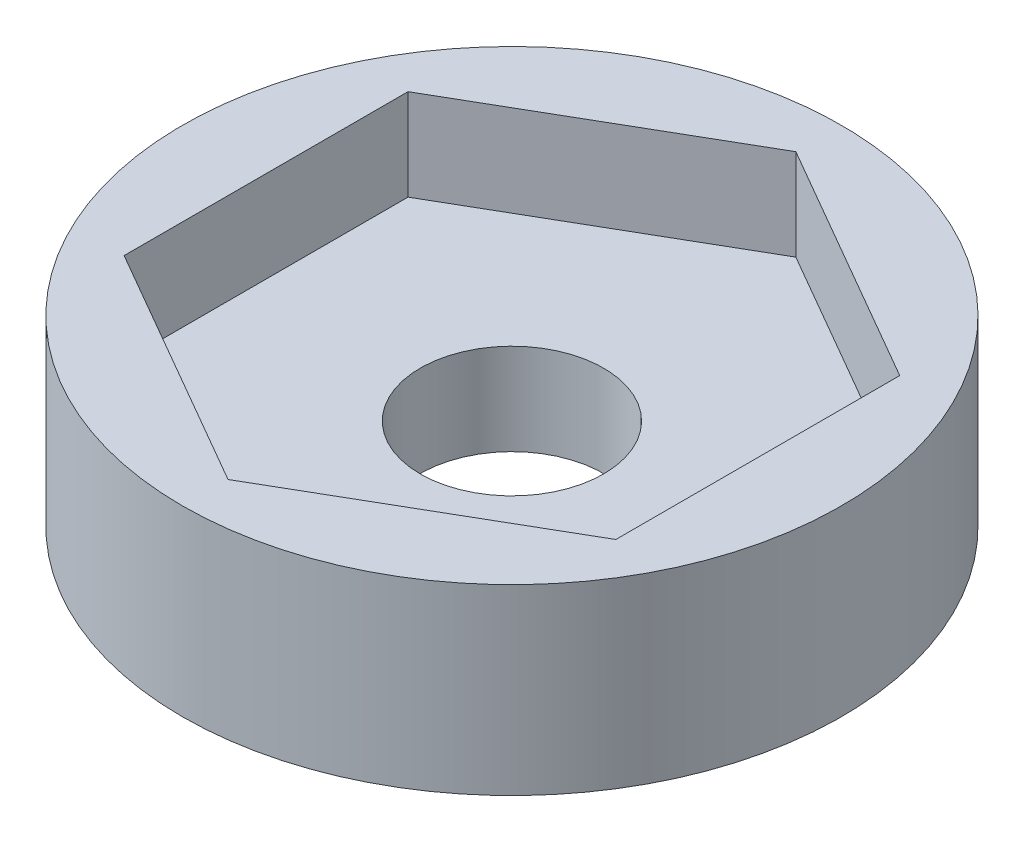
from build123d import *

# Parameters (mm, degrees)
SKETCH1_R           = 11.456840972
BOSS_EXTRUDE1_DEPTH = 3.175
BOSS_EXTRUDE2_START = -3.175
SKETCH2_R           = 11.456840972
SKETCH2_R_2         = 3.1877
BOSS_EXTRUDE2_DEPTH = 3.175


with BuildPart() as part:
    # Sketch1 → Boss-Extrude1 (new body)
    with BuildSketch(Plane(origin=(0, 0, 0), x_dir=(1, 0, 0), z_dir=(0, 1, 0))):
        Circle(SKETCH1_R)
        Polygon((8.5471, 4.934670486), (0, 9.869340972), (-8.5471, 4.934670486), (-8.5471, -4.934670486), (0, -9.869340972), (8.5471, -4.934670486), align=None, mode=Mode.SUBTRACT)
    extrude(amount=BOSS_EXTRUDE1_DEPTH)

    # Sketch2 → Boss-Extrude2 (add)
    with BuildSketch(Plane(origin=(0, 0, 0), x_dir=(1, 0, 0), z_dir=(0, 1, 0)).offset(BOSS_EXTRUDE2_START)):
        Circle(SKETCH2_R)
        Circle(SKETCH2_R_2, mode=Mode.SUBTRACT)
    extrude(amount=BOSS_EXTRUDE2_DEPTH)


solid = part.part
